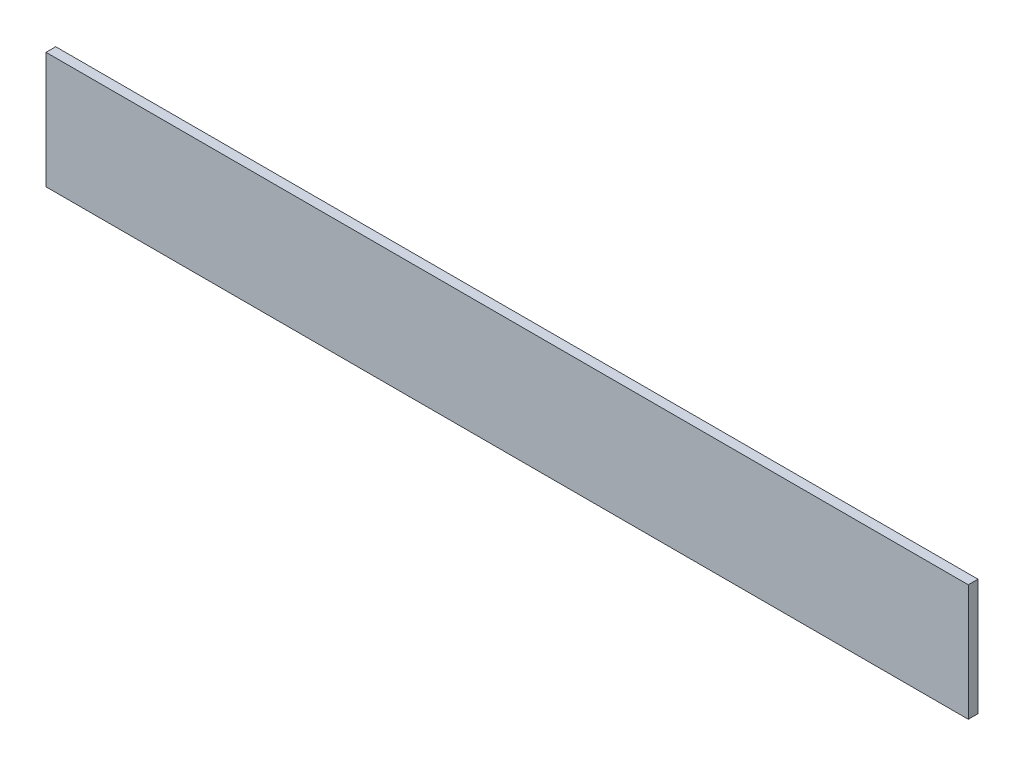
from build123d import *

# Parameters (mm, degrees)
ESQUISSE1_W        = 380
ESQUISSE1_H        = 48
BOSS_EXTRU_1_DEPTH = 4


with BuildPart() as part:
    # Esquisse1 → Boss.-Extru.1 (new body)
    with BuildSketch(Plane.XY):
        with Locations((47.333177467, 46.553691275)):
            Rectangle(ESQUISSE1_W, ESQUISSE1_H)
    extrude(amount=BOSS_EXTRU_1_DEPTH)


solid = part.part
